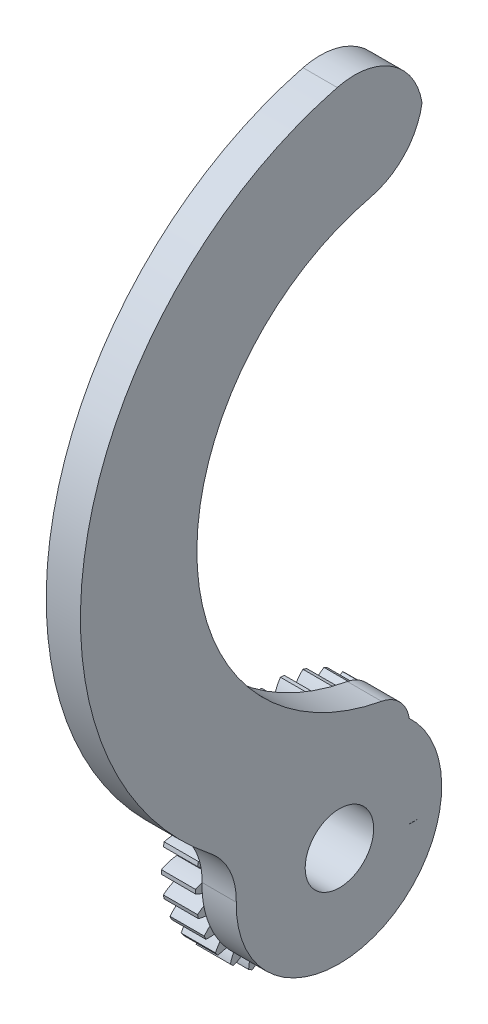
from build123d import *

# Parameters (mm, degrees)
BASPROSKE_W             = 5
BASPROSKE_H             = 16
TOOTHCUT_DEPTH          = 24.173260453
TEETHCUTS_COUNT         = 30
TEETHCUTS_ANGLE         = 348
BORSKE_R                = 0.4
BORE_DEPTH              = 50.0000508
BOSS_EXTRU_1_DEPTH      = 5
ESQUISSE2_R             = 5
ENL_V_MAT_EXTRU_1_DEPTH = 106.472470513
CONG_1_R                = 10
CONG_2_R                = 5


with BuildPart() as part:
    # BasProSke → Base-Revolve (revolve)
    with BuildSketch(Plane(origin=(0, 0, 0), x_dir=(1, 0, 0), z_dir=(0, 1, 0)), mode=Mode.PRIVATE) as base_revolve_sk:
        with Locations((2.5, 8)):
            Rectangle(BASPROSKE_W, BASPROSKE_H)
    revolve(base_revolve_sk.sketch.rotate(Axis((-10, 0, 0), (1, 0, 0)), 180), axis=Axis((-10, 0, 0), (1, 0, 0)))

    # TooCutSke → ToothCut (cut, through all)
    with BuildSketch(Plane(origin=(0, 0, 0), x_dir=(0, 0, -1), z_dir=(1, 0, 0))):
        with BuildLine():
            ThreePointArc((0.466400716, 13.741086979), (0, 13.749), (-0.466400716, 13.741086979))
            ThreePointArc((-0.466400716, 13.741086979), (-0.819142092, 14.899954875), (-1.3974676, 15.964351834))
            ThreePointArc((-1.3974676, 15.964351834), (0, 16.0254), (1.3974676, 15.964351834))
            ThreePointArc((1.3974676, 15.964351834), (0.819142092, 14.899954875), (0.466400716, 13.741086979))
        make_face()
    toothcut = extrude(amount=TOOTHCUT_DEPTH, mode=Mode.SUBTRACT)

    # TeethCuts: ToothCut ×30 about axis
    teethcuts_axis = Axis((-10, 0, 0), (1, 0, 0))
    for i in range(1, TEETHCUTS_COUNT):
        add(toothcut.rotate(teethcuts_axis, i * TEETHCUTS_ANGLE / (TEETHCUTS_COUNT - 1)), mode=Mode.SUBTRACT)

    # BorSke → Bore (cut, symmetric)
    with BuildSketch(Plane(origin=(0, 0, 0), x_dir=(0, 0, -1), z_dir=(1, 0, 0))):
        with Locations(Location((0, 0, 0), (0, 0, 180))):
            Circle(BORSKE_R)
    extrude(amount=BORE_DEPTH, both=True, mode=Mode.SUBTRACT)

    # Esquisse1 → Boss.-Extru.1 (add)
    with BuildSketch(Plane(origin=(5, 0, 0), x_dir=(0, 0, -1), z_dir=(1, 0, 0))):
        with BuildLine():
            ThreePointArc((-14.862256671, -2.048157464), (-0.029312693, -14.604887787), (14.747798814, -1.982499783))
            ThreePointArc((14.747798814, -1.982499783), (13.467452408, -2.031740349), (12.186264665, -2.048157464))
            Line((12.186264665, -2.048157464), (10.186264665, -2.048157464))
            Line((10.186264665, -2.048157464), (-14.862256671, -2.048157464))
        make_face()
        with BuildLine():
            ThreePointArc((10.186264665, -2.008141451), (-2.480579934, 0.151385744), (-14.178752724, 5.467894296))
            ThreePointArc((-14.178752724, 5.467894296), (-15.000931284, 1.753558039), (-14.862256671, -2.048157464))
            Line((-14.862256671, -2.048157464), (10.186264665, -2.048157464))
            Line((10.186264665, -2.048157464), (10.186264665, -2.008141451))
        make_face()
        with BuildLine():
            ThreePointArc((10.186264665, 11.347760413), (-3.581421182, 14.976492037), (-14.178752724, 5.467894296))
            ThreePointArc((-14.178752724, 5.467894296), (-2.480579934, 0.151385744), (10.186264665, -2.008141451))
            Line((10.186264665, -2.008141451), (10.186264665, 4.108432699))
            Line((10.186264665, 4.108432699), (10.186264665, 11.347760413))
        make_face()
        with BuildLine():
            ThreePointArc((12.186264665, -2.048157464), (13.467452408, -2.031740349), (14.747798814, -1.982499783))
            ThreePointArc((14.747798814, -1.982499783), (14.889944213, -0.797487241), (14.937426214, 0.395075336))
            ThreePointArc((14.937426214, 0.395075336), (14.233099979, 4.937509883), (12.186264665, 9.053363654))
            Line((12.186264665, 9.053363654), (12.186264665, 4.108432699))
            Line((12.186264665, 4.108432699), (12.186264665, -2.048157464))
        make_face()
        with BuildLine():
            Line((10.186264665, 4.108432699), (10.186264665, -2.008141451))
            ThreePointArc((10.186264665, -2.008141451), (11.186064525, -2.03815246), (12.186264665, -2.048157464))
            Line((12.186264665, -2.048157464), (12.186264665, 4.108432699))
            Line((12.186264665, 4.108432699), (10.186264665, 4.108432699))
        make_face()
        with BuildLine():
            ThreePointArc((12.186264665, 9.053363654), (11.244611126, 10.251421991), (10.186264665, 11.347760413))
            Line((10.186264665, 11.347760413), (10.186264665, 4.108432699))
            Line((10.186264665, 4.108432699), (12.186264665, 4.108432699))
            Line((12.186264665, 4.108432699), (12.186264665, 9.053363654))
        make_face()
        with BuildLine():
            ThreePointArc((10.186264665, 15.012504352), (-20.798566394, 48.952302412), (12.186264665, 80.951842536))
            Line((12.186264665, 80.951842536), (12.186264665, 97.951842536))
            ThreePointArc((12.186264665, 97.951842536), (-35.898022851, 61.659551826), (-14.178752724, 5.467894296))
            ThreePointArc((-14.178752724, 5.467894296), (-3.581421182, 14.976492037), (10.186264665, 11.347760413))
            Line((10.186264665, 11.347760413), (10.186264665, 15.012504352))
        make_face()
    extrude(amount=BOSS_EXTRU_1_DEPTH)

    # Esquisse2 → Enlèv. mat.-Extru.1 (cut, through all)
    with BuildSketch(Plane.ZY):
        Circle(ESQUISSE2_R)
    extrude(amount=-ENL_V_MAT_EXTRU_1_DEPTH, mode=Mode.SUBTRACT)

    # Congé1
    # the kernel refuses this fillet: 10 mm, written as the material it adds along each edge
    with BuildSketch(Plane(origin=(5, 5.467894296, 14.178752724), x_dir=(0, -0.9833389376848116, 0.181781554710335), z_dir=(1, 0, 0))) as cong_1_piece_1:
        with BuildLine():
            CenterArc((6.459305207, -9.868755545), CONG_1_R, 99.292963857, 52.811448134)
            ThreePointArc((-2.378711391, -5.190137949), (-1.115215442, -2.62904847), (0, 0))
            ThreePointArc((0, 0), (2.422239453, -0.196866682), (4.844478906, 0))
        make_face()
    extrude(amount=5)
    # the kernel refuses this fillet: 10 mm, written as the material it takes off along each edge
    with BuildSketch(Plane(origin=(-26.501073121, 97.951842536, -12.186264665), x_dir=(0, -0.12600429248272704, 0.9920296962671669), z_dir=(1, 0, 0))) as cong_1_2_piece_1:
        with BuildLine():
            CenterArc((11.340386323, 9.920296963), CONG_1_R, 172.761243907, 104.477512186)
            Line((1.420089361, 11.180339887), (0, 0))
            ThreePointArc((0, 0), (6.300214624, -0.398515187), (12.600429248, 0))
        make_face()
    extrude(amount=68.002146241, mode=Mode.SUBTRACT)
    with BuildSketch(Plane(origin=(-17.052618332, 80.951842536, -12.186264665), x_dir=(0, 1, 0), z_dir=(1, 0, 0))) as cong_1_2_piece_2:
        with BuildLine():
            CenterArc((8.821047333, 10), CONG_1_R, 193.447727045, 76.552272955)
            ThreePointArc((-0.904777628, 7.674418605), (-0.226974977, 3.863784527), (0, 0))
            Line((0, 0), (8.821047333, 0))
        make_face()
    extrude(amount=49.105236663, mode=Mode.SUBTRACT)

    # Congé2
    # the kernel refuses this fillet: 5 mm, written as the material it takes off along each edge
    with BuildSketch(Plane(origin=(5, 15.012504352, -10.186264665), x_dir=(0, -1, 0), z_dir=(1, 0, 0))) as cong_2_piece_1:
        with BuildLine():
            CenterArc((4.421098447, -4.94246172), CONG_2_R, 98.700584349, 70.772560885)
            ThreePointArc((-0.494748478, -4.028979915), (-0.185366267, -2.022104379), (0, 0))
            Line((0, 0), (3.664743939, 0))
        make_face()
    extrude(amount=15.148107956, mode=Mode.SUBTRACT)


solid = part.part
